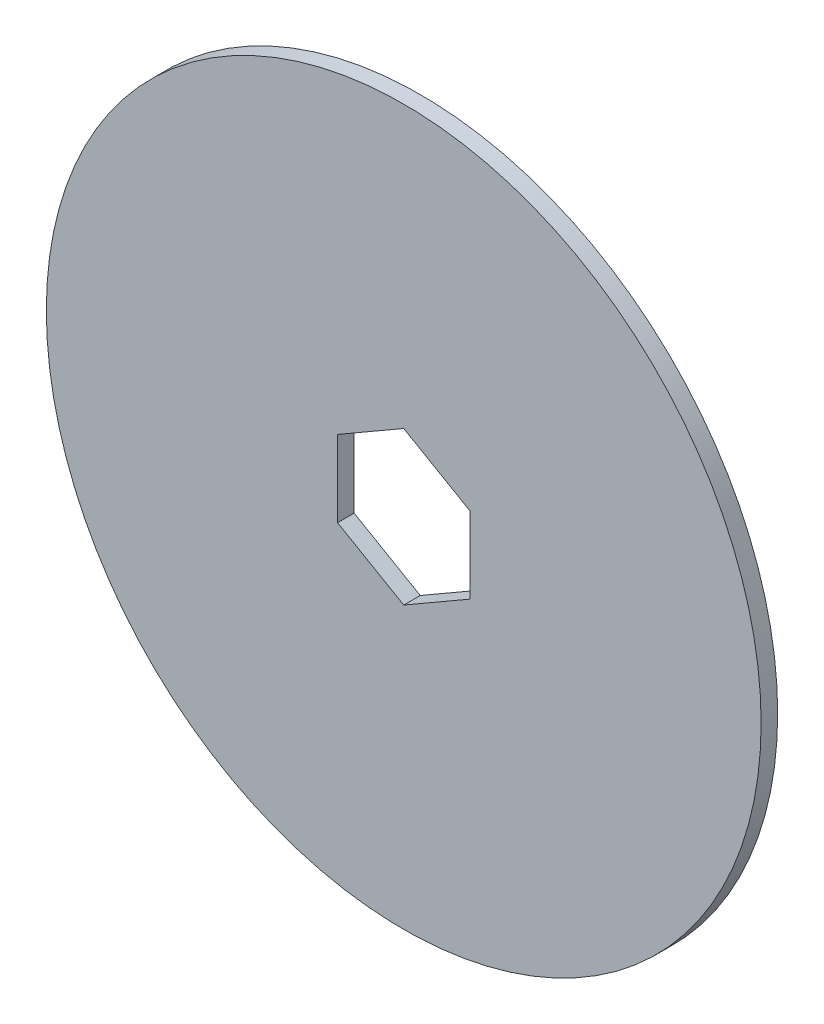
from build123d import *

# Parameters (mm, degrees)
SKETCH1_R           = 34.29
BOSS_EXTRUDE1_DEPTH = 1.5875


with BuildPart() as part:
    # Sketch1 → Boss-Extrude1 (new body)
    with BuildSketch(Plane.XY):
        Circle(SKETCH1_R)
        Polygon((0, 7.332348419), (-6.35, 3.666174209), (-6.35, -3.666174209), (0, -7.332348419), (6.35, -3.666174209), (6.35, 3.666174209), align=None, mode=Mode.SUBTRACT)
    extrude(amount=BOSS_EXTRUDE1_DEPTH)


solid = part.part
